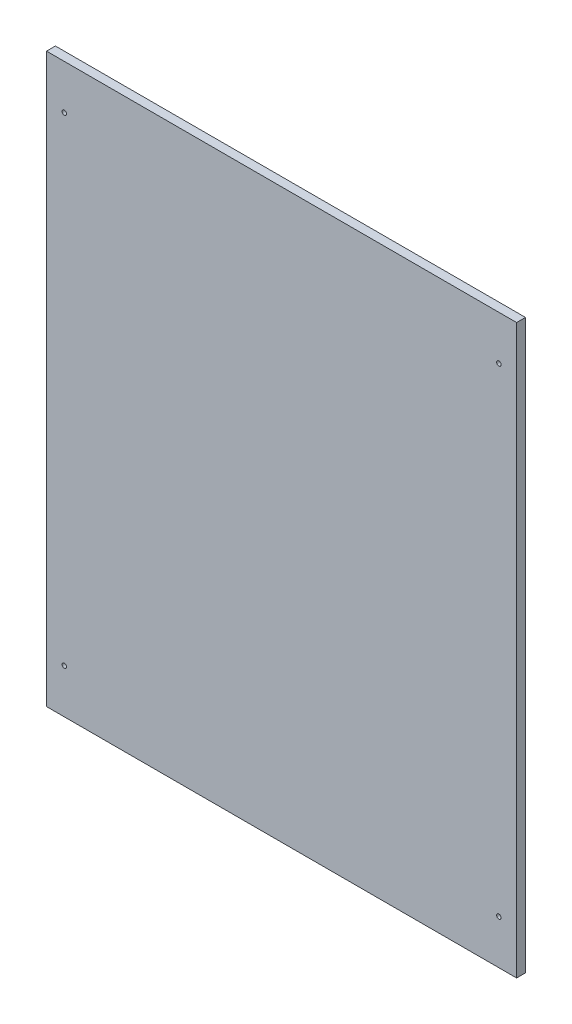
from build123d import *

# Parameters (mm, degrees)
SKETCH_3_W                  = 530
SKETCH_3_H                  = 640
EXTRUDE_1_DEPTH             = 10
SKETCH_4_R                  = 2.5
CUT_EXTRUDE_1_DEPTH         = 416.601973046
PATTERN_LINEAR_1_COUNT      = 2
PATTERN_LINEAR_1_PITCH      = 490
PATTERN_LINEAR_1_COUNT_DIR2 = 2
PATTERN_LINEAR_1_PITCH_DIR2 = 540


with BuildPart() as part:
    # Эскиз3 → Бобышка-Вытянуть1 (new body)
    with BuildSketch(Plane.XY):
        Rectangle(SKETCH_3_W, SKETCH_3_H)
    extrude(amount=EXTRUDE_1_DEPTH)

    # Эскиз4 → Вырез-Вытянуть1 (cut, through all)
    with BuildSketch(Plane.XY.offset(10)):
        with Locations((-245, 270)):
            Circle(SKETCH_4_R)
    cut_extrude_1 = extrude(amount=-CUT_EXTRUDE_1_DEPTH, mode=Mode.SUBTRACT)

    # Линейный массив1: Cut-Extrude 1 2 × 2
    with Locations(*[(i * PATTERN_LINEAR_1_PITCH, -j * PATTERN_LINEAR_1_PITCH_DIR2, 0) for i in range(PATTERN_LINEAR_1_COUNT) for j in range(PATTERN_LINEAR_1_COUNT_DIR2) if (i, j) != (0, 0)]):
        add(cut_extrude_1, mode=Mode.SUBTRACT)


solid = part.part
